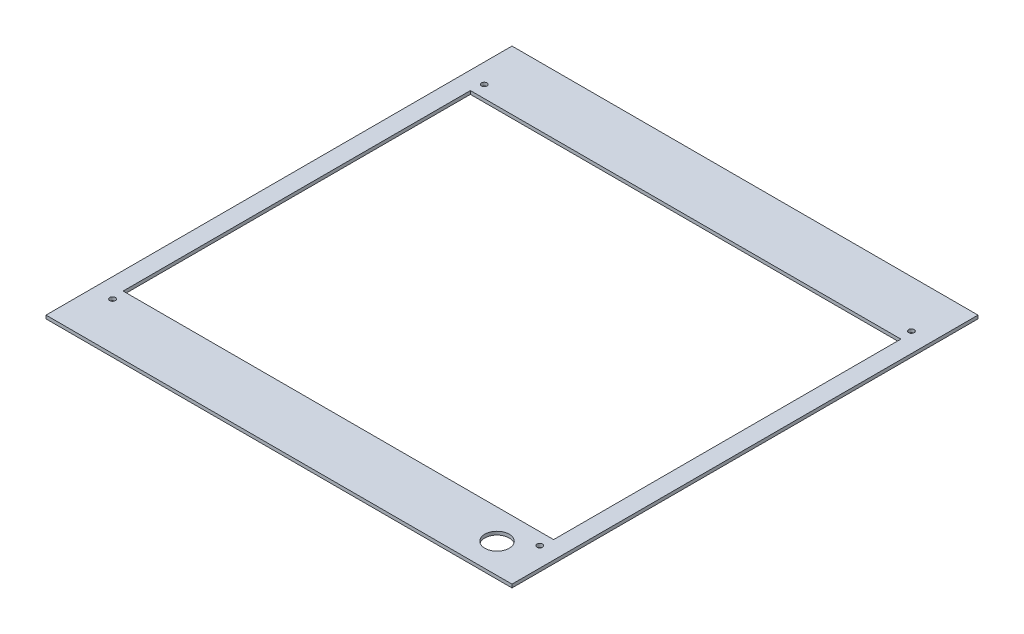
from build123d import *

# Parameters (mm, degrees)
SKETCH1_W           = 420
SKETCH1_H           = 420
SKETCH1_R           = 11
SKETCH1_W_2         = 388
SKETCH1_H_2         = 313
BOSS_EXTRUDE1_DEPTH = 3


with BuildPart() as part:
    # Sketch1 → Boss-Extrude1 (new body)
    with BuildSketch(Plane(origin=(0, 0, 0), x_dir=(1, 0, 0), z_dir=(0, 1, 0))):
        Rectangle(SKETCH1_W, SKETCH1_H)
        with Locations((169.75, -183.25)):
            Circle(SKETCH1_R, mode=Mode.SUBTRACT)
        Rectangle(SKETCH1_W_2, SKETCH1_H_2, mode=Mode.SUBTRACT)
        with BuildLine():
            ThreePointArc((-192.5, -170), (-190.732233047, -165.732233047), (-195, -167.5))
            ThreePointArc((-195, -167.5), (-194.267766953, -169.267766953), (-192.5, -170))
        make_face(mode=Mode.SUBTRACT)
        with BuildLine():
            ThreePointArc((192.5, -165), (190.732233047, -169.267766953), (195, -167.5))
            ThreePointArc((195, -167.5), (194.267766953, -165.732233047), (192.5, -165))
        make_face(mode=Mode.SUBTRACT)
        with BuildLine():
            ThreePointArc((195, 167.5), (194.267766953, 169.267766953), (192.5, 170))
            ThreePointArc((192.5, 170), (190.732233047, 165.732233047), (195, 167.5))
        make_face(mode=Mode.SUBTRACT)
        with BuildLine():
            ThreePointArc((-195, 167.5), (-194.267766953, 165.732233047), (-192.5, 165))
            ThreePointArc((-192.5, 165), (-190.732233047, 169.267766953), (-195, 167.5))
        make_face(mode=Mode.SUBTRACT)
    extrude(amount=BOSS_EXTRUDE1_DEPTH)


solid = part.part
